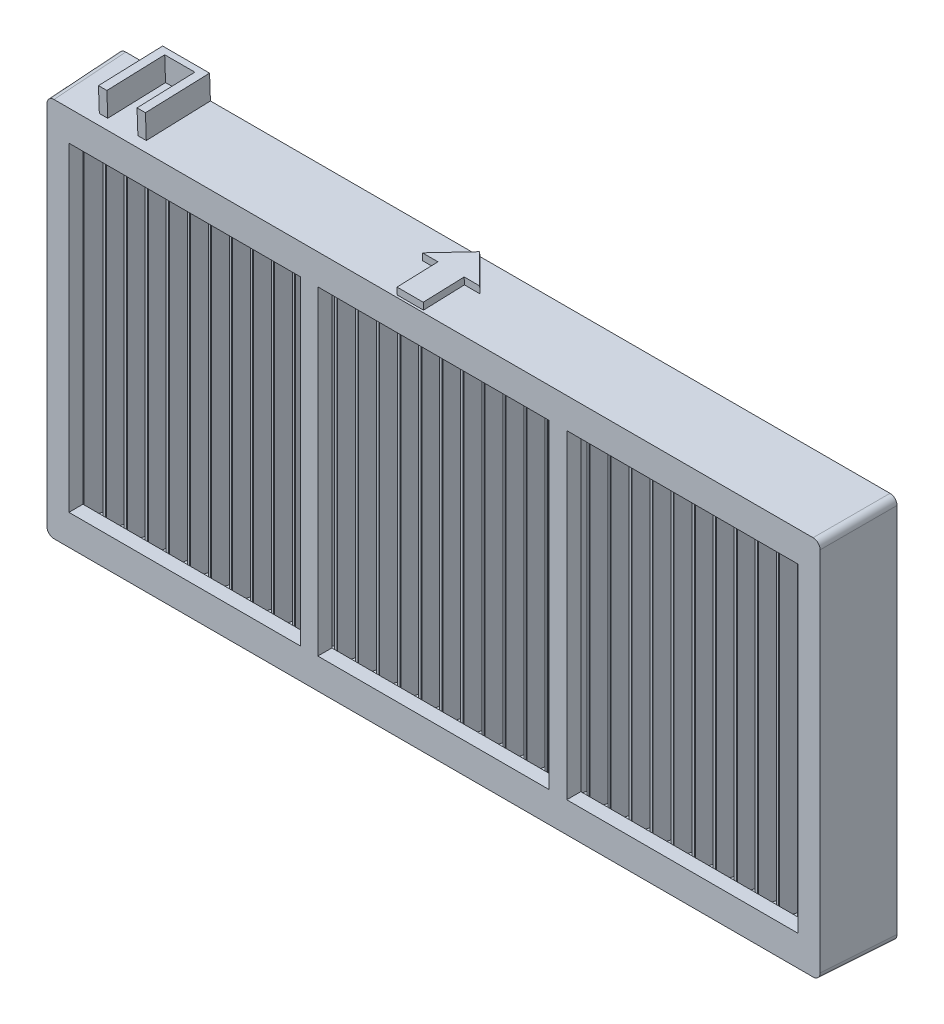
from build123d import *

# Parameters (mm, degrees)
SKETCH1_W               = 111
SKETCH1_H               = 55
BOSS_EXTRUDE1_DEPTH     = 10.6
BOSS_EXTRUDE1_TAPER     = 2
SHELL1_T                = 2
SKETCH3_W               = 32
SKETCH3_H               = 22
SKETCH3_H_2             = 22.3
SKETCH3_W_2             = 34.8
FILTERCUTOUTBACK_DEPTH  = 2
SKETCH4_W               = 33
SKETCH4_H               = 45.6
FILTERCUTOUTFRONT_DEPTH = 2
FILLET1_R               = 1
TAB_DEPTH               = 3.5
DIRECTIONARROW_DEPTH    = 1
INTERNALFILTER_DEPTH    = 0.2
BOSS_EXTRUDE6_REACH     = 2982.639
BOSS_EXTRUDE6_START     = 3
LPATTERN1_COUNT         = 35
LPATTERN1_PITCH         = 3


with BuildPart() as part:
    # Sketch1 → Boss-Extrude1 (new body)
    with BuildSketch(Plane.XY):
        with Locations((55.5, 27.5)):
            Rectangle(SKETCH1_W, SKETCH1_H)
    extrude(amount=BOSS_EXTRUDE1_DEPTH, taper=BOSS_EXTRUDE1_TAPER)

    # Shell1 (no face opened: a closed hollow body)
    add(offset(amount=-SHELL1_T, mode=Mode.PRIVATE), mode=Mode.SUBTRACT)

    # Sketch3 → FilterCutoutBack (cut)
    with BuildSketch(Plane(origin=(0, 0, 0), x_dir=(-1, 0, 0), z_dir=(0, 0, -1))):
        with Locations((-90.4, 39.4)):
            Rectangle(SKETCH3_W, SKETCH3_H)
        with Locations((-90.4, 15.75)):
            Rectangle(SKETCH3_W, SKETCH3_H_2)
        with Locations((-55.5, 39.4)):
            Rectangle(SKETCH3_W_2, SKETCH3_H)
        with Locations((-20.6, 39.4)):
            Rectangle(SKETCH3_W, SKETCH3_H)
        with Locations((-55.5, 15.75)):
            Rectangle(SKETCH3_W_2, SKETCH3_H_2)
        with Locations((-20.6, 15.75)):
            Rectangle(SKETCH3_W, SKETCH3_H_2)
    extrude(amount=-FILTERCUTOUTBACK_DEPTH, mode=Mode.SUBTRACT)

    # Sketch4 → FilterCutoutFront (cut)
    with BuildSketch(Plane.XY.offset(10.6)):
        with Locations((20, 27.5)):
            Rectangle(SKETCH4_W, SKETCH4_H)
        with Locations((55.5, 27.5)):
            Rectangle(SKETCH4_W, SKETCH4_H)
        with Locations((91, 27.5)):
            Rectangle(SKETCH4_W, SKETCH4_H)
    extrude(amount=-FILTERCUTOUTFRONT_DEPTH, mode=Mode.SUBTRACT)

    # Fillet1
    fillet1_edges = [part.edges().sort_by_distance(p)[0] for p in [
        (110.814919922, 0.185080078, 5.3),
        (110.814919922, 54.814919922, 5.3),
        (0.185080078, 0.185080078, 5.3),
        (0.185080078, 54.814919922, 5.3),
    ]]
    fillet(fillet1_edges, radius=FILLET1_R)

    # Sketch5 → TAB (add)
    with BuildSketch(Plane(origin=(0, 54.933011382, 1.918303028), x_dir=(1, 0, 0), z_dir=(0, 0.9993908270190958, 0.03489949670250101))):
        Polygon((13.08, -7.230527681), (13.08, 1.919472319), (6.38, 1.919472319), (6.38, -7.230527681), (7.58, -7.230527681), (7.58, 1.019472319), (11.88, 1.019472319), (11.88, -7.230527681), align=None)
    extrude(amount=TAB_DEPTH)

    # Sketch6 → DirectionArrow (add)
    with BuildSketch(Plane(origin=(0, 54.933011382, 1.918303028), x_dir=(1, 0, 0), z_dir=(0, 0.9993908270190958, 0.03489949670250101))):
        Polygon((47.799081744, -2.533690102), (51.883425318, 1.550653472), (55.967768891, -2.533690102), (53.753860362, -2.533690102), (53.753860362, -8.373718505), (50.012990273, -8.373718505), (50.012990273, -2.533690102), align=None)
    extrude(amount=DIRECTIONARROW_DEPTH)

    # Sketch7 → InternalFilter (add)
    with BuildSketch(Plane(origin=(0, 0, 2974.994420517), x_dir=(-1, 0, 0), z_dir=(0, 1, 0))):
        Polygon((-108.448462294, -2966.394420517), (-107.271559358, -2972.744420517), (-105.629337698, -2966.394420517), (-105.379337698, -2966.394420517), (-107.086213755, -2972.994420517), (-107.475224597, -2972.994420517), (-108.698462294, -2966.394420517), align=None)
    extrude(amount=INTERNALFILTER_DEPTH)

    # Boss-Extrude6: up to this plane
    boss_extrude6_end = Plane(origin=(0, 53.001218346, -0.069798993), z_dir=(0, 0.9993908270190958, 0.034899496702501004))
    # Sketch7<3> → Boss-Extrude6 (add, up to the surface)
    with BuildSketch(Plane(origin=(0, 0, 2974.994420517), x_dir=(-1, 0, 0), z_dir=(0, 1, 0)).offset(BOSS_EXTRUDE6_START), mode=Mode.PRIVATE) as boss_extrude6_sk1:
        Polygon((-108.448462294, -2966.394420517), (-107.271559358, -2972.744420517), (-105.629337698, -2966.394420517), (-105.379337698, -2966.394420517), (-107.086213755, -2972.994420517), (-107.475224597, -2972.994420517), (-108.698462294, -2966.394420517), align=None)
    boss_extrude6_tool1 = split(extrude(boss_extrude6_sk1.sketch, amount=BOSS_EXTRUDE6_REACH, mode=Mode.PRIVATE), bisect_by=boss_extrude6_end, keep=Keep.BOTH, mode=Mode.PRIVATE)
    boss_extrude6 = boss_extrude6_tool1.solids().sort_by_distance((107.93265, 3, 5.411537))[0]
    add(boss_extrude6)

    # LPattern1: Boss-Extrude6 ×35
    with Locations(*[(-i * LPATTERN1_PITCH, 0, 0) for i in range(1, LPATTERN1_COUNT)]):
        add(boss_extrude6)


solid = part.part
